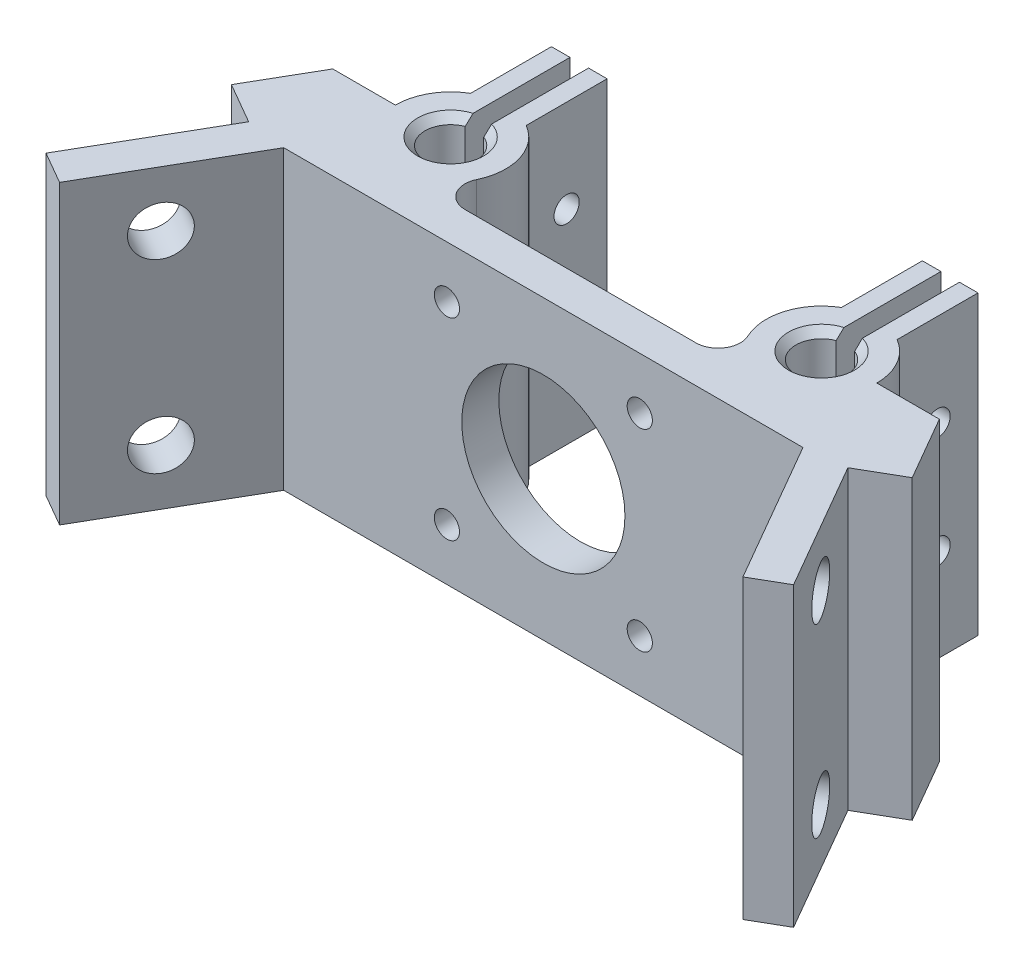
from build123d import *

# Parameters (mm, degrees)
BOSS_EXTRUDE1_DEPTH = 40
SKETCH2_R           = 1.7
CUT_EXTRUDE1_DEPTH  = 28.75
SKETCH4_R           = 1.7
SKETCH4_R_2         = 11
CUT_EXTRUDE2_DEPTH  = 20
CHAMFER1_SIZE       = 1
CUT_EXTRUDE3_REACH  = 162.798
SKETCH5_R           = 3.3


with BuildPart() as part:
    # Sketch1 → Boss-Extrude1 (new body)
    with BuildSketch(Plane(origin=(0, 0, 0), x_dir=(1, 0, 0), z_dir=(0, 1, 0))):
        with BuildLine():
            ThreePointArc((26.25, 120.715587038), (25, 114.05), (23.75, 120.715587038))
            Line((23.75, 120.715587038), (23.75, 134.844385611))
            Line((23.75, 134.844385611), (21.25, 134.844385611))
            Line((21.25, 134.844385611), (21.25, 123.937390776))
            ThreePointArc((21.25, 123.937390776), (17.8806949, 119.694993142), (18.276133819, 114.291866029))
            ThreePointArc((18.276133819, 114.291866029), (18.105818521, 111.399312349), (15.568536699, 110))
            Line((15.568536699, 110), (-15.568536699, 110))
            ThreePointArc((-15.568536699, 110), (-18.105818521, 111.399312349), (-18.276133819, 114.291866029))
            ThreePointArc((-18.276133819, 114.291866029), (-17.8806949, 119.694993142), (-21.25, 123.937390776))
            Line((-21.25, 123.937390776), (-21.25, 134.844385611))
            Line((-21.25, 134.844385611), (-23.75, 134.844385611))
            Line((-23.75, 134.844385611), (-23.75, 120.715587038))
            ThreePointArc((-23.75, 120.715587038), (-25, 114.05), (-26.25, 120.715587038))
            Line((-26.25, 120.715587038), (-26.25, 134.844385611))
            Line((-26.25, 134.844385611), (-28.75, 134.844385611))
            Line((-28.75, 134.844385611), (-28.75, 123.937390776))
            ThreePointArc((-28.75, 123.937390776), (-31.459102105, 121.212478956), (-32.45, 117.5))
            Line((-32.45, 117.5), (-40.888972746, 117.5))
            Line((-40.888972746, 117.5), (-45.888972746, 108.839745962))
            Line((-45.888972746, 108.839745962), (-40.389711432, 105.664745962))
            Line((-40.389711432, 105.664745962), (-50.389711432, 88.344237886))
            Line((-50.389711432, 88.344237886), (-46.059584413, 85.844237886))
            Line((-46.059584413, 85.844237886), (-35, 105))
            Line((-35, 105), (35, 105))
            Line((35, 105), (46.059584413, 85.844237886))
            Line((46.059584413, 85.844237886), (50.389711432, 88.344237886))
            Line((50.389711432, 88.344237886), (40.389711432, 105.664745962))
            Line((40.389711432, 105.664745962), (45.888972746, 108.839745962))
            Line((45.888972746, 108.839745962), (40.888972746, 117.5))
            Line((40.888972746, 117.5), (32.45, 117.5))
            ThreePointArc((32.45, 117.5), (31.459102105, 121.212478956), (28.75, 123.937390776))
            Line((28.75, 123.937390776), (28.75, 134.844385611))
            Line((28.75, 134.844385611), (26.25, 134.844385611))
            Line((26.25, 134.844385611), (26.25, 120.715587038))
        make_face()
    extrude(amount=BOSS_EXTRUDE1_DEPTH)

    # Sketch2 → Cut-Extrude1 (cut, symmetric)
    with BuildSketch(Plane(origin=(0, 0, 0), x_dir=(0, 0, -1), z_dir=(1, 0, 0))):
        with Locations((129.390888193, 27.5)):
            Circle(SKETCH2_R)
        with Locations((129.390888193, 12.5)):
            Circle(SKETCH2_R)
    extrude(amount=CUT_EXTRUDE1_DEPTH, both=True, mode=Mode.SUBTRACT)

    # Sketch4 → Cut-Extrude2 (cut)
    with BuildSketch(Plane.XY.offset(-105)):
        with Locations((-13, 33)):
            Circle(SKETCH4_R)
        with Locations((13, 33)):
            Circle(SKETCH4_R)
        with Locations((13, 7)):
            Circle(SKETCH4_R)
        with Locations((-13, 7)):
            Circle(SKETCH4_R)
        with Locations((0, 20)):
            Circle(SKETCH4_R_2)
    extrude(amount=-CUT_EXTRUDE2_DEPTH, mode=Mode.SUBTRACT)

    # Chamfer1
    chamfer1_edges = [part.edges().sort_by_distance(p)[0] for p in [
        (25, 40, -114.05),
        (-25, 40, -114.05),
    ]]
    chamfer(chamfer1_edges, length=CHAMFER1_SIZE)

    # Sketch5 → Cut-Extrude3 (cut, up to next)
    with BuildSketch(Plane(origin=(-76.046460718, 0, -43.905444566), x_dir=(-0.49999999999998673, 0, 0.8660254037844464), z_dir=(-0.8660254037844464, 0, -0.49999999999998673)), mode=Mode.PRIVATE) as cut_extrude3_sk1:
        with Locations((-61.313498572, 32.5)):
            Circle(SKETCH5_R)
    cut_extrude3_tool1 = extrude(cut_extrude3_sk1.sketch, amount=-CUT_EXTRUDE3_REACH, mode=Mode.PRIVATE) & part.part
    # Sketch5 → Cut-Extrude3 (cut, up to next)
    with BuildSketch(Plane(origin=(-76.046460718, 0, -43.905444566), x_dir=(-0.49999999999998673, 0, 0.8660254037844464), z_dir=(-0.8660254037844464, 0, -0.49999999999998673)), mode=Mode.PRIVATE) as cut_extrude3_sk2:
        with Locations((-61.313498572, 7.5)):
            Circle(SKETCH5_R)
    cut_extrude3_tool2 = extrude(cut_extrude3_sk2.sketch, amount=-CUT_EXTRUDE3_REACH, mode=Mode.PRIVATE) & part.part
    cut_extrude3_1 = cut_extrude3_tool1.solids().sort_by_distance((-45.389711, 32.5, -97.004492))[0]
    add(cut_extrude3_1, mode=Mode.SUBTRACT)
    cut_extrude3_2 = cut_extrude3_tool2.solids().sort_by_distance((-45.389711, 7.5, -97.004492))[0]
    add(cut_extrude3_2, mode=Mode.SUBTRACT)
    cut_extrude3 = cut_extrude3_1 + cut_extrude3_2  # Cut-Extrude3 as one shape, for the pattern or mirror that repeats it

    # Mirror1: Cut-Extrude3 across plane
    add(cut_extrude3.mirror(Plane(origin=(0, 0, 0), x_dir=(0, 0, 1), z_dir=(1, 0, 0))), mode=Mode.SUBTRACT)


solid = part.part
